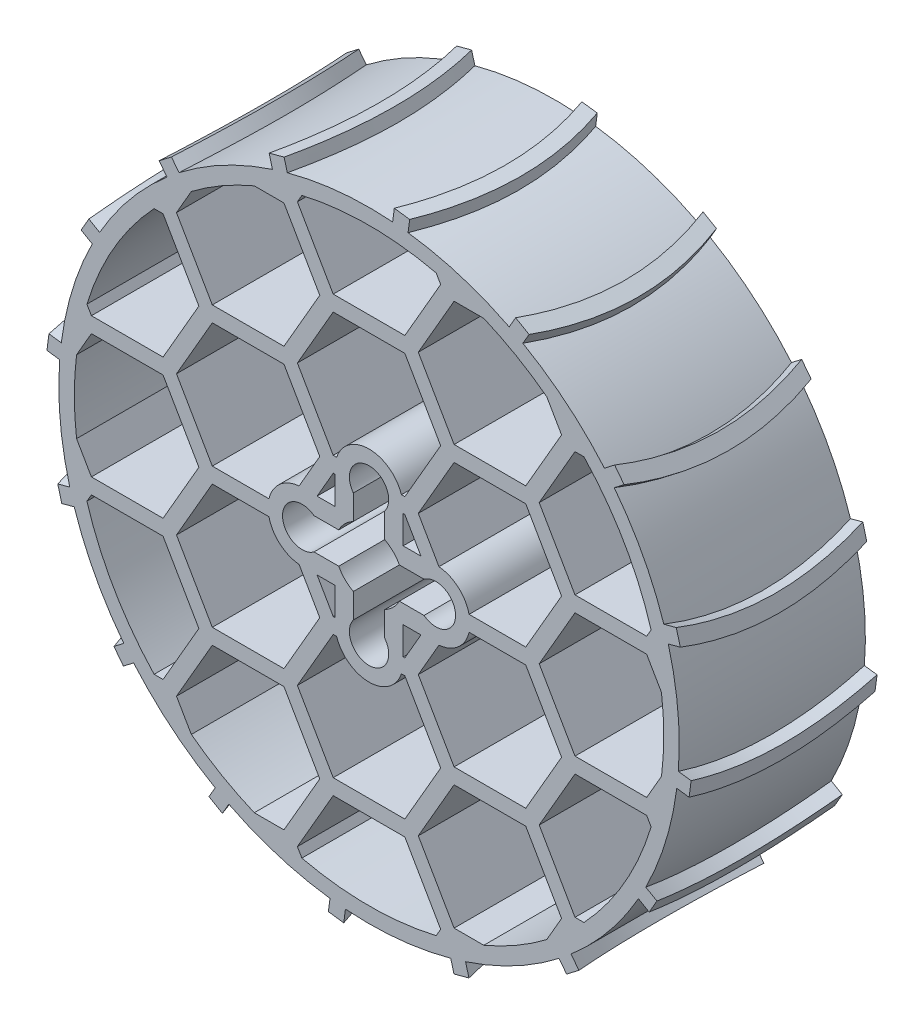
from build123d import *

# Parameters (mm, degrees)
BOSS_EXTRUDE1_DEPTH = 60
SKETCH1_4_R         = 6.338999997
SKETCH1_4_R_2       = 3.302
SKETCH1_4_R_3       = 6.339
SKETCH1_4_R_4       = 6.338999989
BOSS_EXTRUDE2_DEPTH = 10
SKETCH1_6_R         = 6.339
SKETCH1_6_R_2       = 3.302
SKETCH1_6_R_3       = 6.338999989
SKETCH1_6_R_4       = 6.338999997
BOSS_EXTRUDE4_DEPTH = 30
SKETCH1_7_R         = 100
SKETCH1_7_R_2       = 95
BOSS_EXTRUDE5_DEPTH = 60
BOSS_EXTRUDE6_START = -0.149920562
BOSS_EXTRUDE6_DEPTH = 4.149920562
CIRPATTERN3_COUNT   = 16


with BuildPart() as part:
    # Sketch1 → Boss-Extrude1 (new body)
    with BuildSketch(Plane.XY):
        with BuildLine():
            Line((-11.547005384, 70), (-23.094010768, 90))
            Line((-23.094010768, 90), (-21.650635095, 92.5))
            ThreePointArc((-21.650635095, 92.5), (-29.430004682, 90.326490159), (-36.996621467, 87.5))
            Line((-36.996621467, 87.5), (-27.424137787, 87.5))
            Line((-27.424137787, 87.5), (-15.877132403, 67.5))
            Line((-15.877132403, 67.5), (-27.424137787, 47.5))
            Line((-27.424137787, 47.5), (-50.518148554, 47.5))
            Line((-50.518148554, 47.5), (-62.065153938, 67.5))
            Line((-62.065153938, 67.5), (-57.278912097, 75.790014045))
            ThreePointArc((-57.278912097, 75.790014045), (-63.510032772, 70.650376767), (-69.282032303, 65))
            Line((-69.282032303, 65), (-66.395280957, 65))
            Line((-66.395280957, 65), (-54.848275573, 45))
            Line((-54.848275573, 45), (-66.395280957, 25))
            Line((-66.395280957, 25), (-89.489291724, 25))
            Line((-89.489291724, 25), (-90.932667397, 27.5))
            ThreePointArc((-90.932667397, 27.5), (-92.940037453, 19.676113392), (-94.275533565, 11.709985955))
            Line((-94.275533565, 11.709985955), (-89.489291724, 20))
            Line((-89.489291724, 20), (-66.395280957, 20))
            Line((-66.395280957, 20), (-54.848275573, 0))
            Line((-54.848275573, 0), (-66.395280957, -20))
            Line((-66.395280957, -20), (-89.489291724, -20))
            Line((-89.489291724, -20), (-94.275533565, -11.709985955))
            ThreePointArc((-94.275533565, -11.709985955), (-92.940037453, -19.676113392), (-90.932667397, -27.5))
            Line((-90.932667397, -27.5), (-89.489291724, -25))
            Line((-89.489291724, -25), (-66.395280957, -25))
            Line((-66.395280957, -25), (-54.848275573, -45))
            Line((-54.848275573, -45), (-66.395280957, -65))
            Line((-66.395280957, -65), (-69.282032303, -65))
            ThreePointArc((-69.282032303, -65), (-63.510032772, -70.650376767), (-57.278912097, -75.790014045))
            Line((-57.278912097, -75.790014045), (-62.065153938, -67.5))
            Line((-62.065153938, -67.5), (-50.518148554, -47.5))
            Line((-50.518148554, -47.5), (-27.424137786, -47.5))
            Line((-27.424137786, -47.5), (-15.877132403, -67.5))
            Line((-15.877132403, -67.5), (-27.424137787, -87.5))
            Line((-27.424137787, -87.5), (-36.996621467, -87.5))
            ThreePointArc((-36.996621467, -87.5), (-29.430004682, -90.326490159), (-21.650635095, -92.5))
            Line((-21.650635095, -92.5), (-23.094010768, -90))
            Line((-23.094010768, -90), (-11.547005384, -70))
            Line((-11.547005384, -70), (11.547005384, -70))
            Line((11.547005384, -70), (23.094010768, -90))
            Line((23.094010768, -90), (21.650635095, -92.5))
            ThreePointArc((21.650635095, -92.5), (29.430004682, -90.326490159), (36.996621467, -87.5))
            Line((36.996621467, -87.5), (27.424137787, -87.5))
            Line((27.424137787, -87.5), (15.877132403, -67.5))
            Line((15.877132403, -67.5), (27.424137787, -47.5))
            Line((27.424137787, -47.5), (50.518148554, -47.5))
            Line((50.518148554, -47.5), (62.065153938, -67.5))
            Line((62.065153938, -67.5), (57.278912097, -75.790014045))
            ThreePointArc((57.278912097, -75.790014045), (63.510032772, -70.650376767), (69.282032303, -65))
            Line((69.282032303, -65), (66.395280957, -65))
            Line((66.395280957, -65), (54.848275573, -45))
            Line((54.848275573, -45), (66.395280957, -25))
            Line((66.395280957, -25), (89.489291724, -25))
            Line((89.489291724, -25), (90.932667397, -27.5))
            ThreePointArc((90.932667397, -27.5), (92.940037453, -19.676113392), (94.275533565, -11.709985955))
            Line((94.275533565, -11.709985955), (89.489291724, -20))
            Line((89.489291724, -20), (66.395280957, -20))
            Line((66.395280957, -20), (54.848275573, 0))
            Line((54.848275573, 0), (66.395280957, 20))
            Line((66.395280957, 20), (89.489291724, 20))
            Line((89.489291724, 20), (94.275533565, 11.709985955))
            ThreePointArc((94.275533565, 11.709985955), (92.940037453, 19.676113392), (90.932667397, 27.5))
            Line((90.932667397, 27.5), (89.489291724, 25))
            Line((89.489291724, 25), (66.395280957, 25))
            Line((66.395280957, 25), (54.848275573, 45))
            Line((54.848275573, 45), (66.395280957, 65))
            Line((66.395280957, 65), (69.282032303, 65))
            ThreePointArc((69.282032303, 65), (63.510032772, 70.650376767), (57.278912097, 75.790014045))
            Line((57.278912097, 75.790014045), (62.065153938, 67.5))
            Line((62.065153938, 67.5), (50.518148554, 47.5))
            Line((50.518148554, 47.5), (27.424137787, 47.5))
            Line((27.424137787, 47.5), (15.877132403, 67.5))
            Line((15.877132403, 67.5), (27.424137787, 87.5))
            Line((27.424137787, 87.5), (36.996621467, 87.5))
            ThreePointArc((36.996621467, 87.5), (29.430004682, 90.326490159), (21.650635095, 92.5))
            Line((21.650635095, 92.5), (23.094010768, 90))
            Line((23.094010768, 90), (11.547005384, 70))
            Line((11.547005384, 70), (-11.547005384, 70))
        make_face()
        Polygon((-10.999999956, 20), (-10.999999956, 11.000000024), (-16.743157793, 11.000000024), (-11.547005384, 20), align=None, mode=Mode.SUBTRACT)
        with BuildLine():
            ThreePointArc((10.444314098, 25), (5.1e-08, 32.547999973), (-10.444313996, 25))
            Line((-10.444313996, 25), (-11.547005384, 25))
            Line((-11.547005384, 25), (-23.094010768, 45))
            Line((-23.094010768, 45), (-11.547005384, 65))
            Line((-11.547005384, 65), (11.547005384, 65))
            Line((11.547005384, 65), (23.094010768, 45))
            Line((23.094010768, 45), (11.547005384, 25))
            Line((11.547005384, 25), (10.444314098, 25))
        make_face(mode=Mode.SUBTRACT)
        Polygon((11.000000057, 11.000000006), (11.000000057, 20), (11.547005384, 20), (16.743157803, 11.000000006), align=None, mode=Mode.SUBTRACT)
        with BuildLine():
            ThreePointArc((-22.54267841, 10.954935656), (-28.768380763, 8.298560168), (-32.26014257, 2.5))
            Line((-32.26014257, 2.5), (-50.518148554, 2.5))
            Line((-50.518148554, 2.5), (-62.065153938, 22.5))
            Line((-62.065153938, 22.5), (-50.518148554, 42.5))
            Line((-50.518148554, 42.5), (-27.424137787, 42.5))
            Line((-27.424137787, 42.5), (-15.877132403, 22.5))
            Line((-15.877132403, 22.5), (-22.54267841, 10.954935656))
        make_face(mode=Mode.SUBTRACT)
        with BuildLine():
            ThreePointArc((-32.260142561, -2.5), (-28.768380758, -8.298560137), (-22.542678431, -10.954935619))
            Line((-22.542678431, -10.954935619), (-15.877132403, -22.5))
            Line((-15.877132403, -22.5), (-27.424137787, -42.5))
            Line((-27.424137787, -42.5), (-50.518148554, -42.5))
            Line((-50.518148554, -42.5), (-62.065153938, -22.5))
            Line((-62.065153938, -22.5), (-50.518148554, -2.5))
            Line((-50.518148554, -2.5), (-32.260142561, -2.5))
        make_face(mode=Mode.SUBTRACT)
        with BuildLine():
            ThreePointArc((32.260142649, 2.5), (28.768380811, 8.298560182), (22.542678416, 10.954935645))
            Line((22.542678416, 10.954935645), (15.877132403, 22.5))
            Line((15.877132403, 22.5), (27.424137787, 42.5))
            Line((27.424137787, 42.5), (50.518148554, 42.5))
            Line((50.518148554, 42.5), (62.065153938, 22.5))
            Line((62.065153938, 22.5), (50.518148554, 2.5))
            Line((50.518148554, 2.5), (32.260142649, 2.5))
        make_face(mode=Mode.SUBTRACT)
        Polygon((-16.743157813, -10.999999989), (-10.999999973, -10.999999989), (-10.999999973, -20), (-11.547005384, -20), align=None, mode=Mode.SUBTRACT)
        with BuildLine():
            ThreePointArc((22.542678416, -10.954935645), (28.768380811, -8.298560182), (32.260142649, -2.5))
            Line((32.260142649, -2.5), (50.518148554, -2.5))
            Line((50.518148554, -2.5), (62.065153938, -22.5))
            Line((62.065153938, -22.5), (50.518148554, -42.5))
            Line((50.518148554, -42.5), (27.424137787, -42.5))
            Line((27.424137787, -42.5), (15.877132403, -22.5))
            Line((15.877132403, -22.5), (22.542678416, -10.954935645))
        make_face(mode=Mode.SUBTRACT)
        with BuildLine():
            ThreePointArc((-10.444314008, -25), (3.3e-08, -32.547999956), (10.444314074, -25))
            Line((10.444314074, -25), (11.547005384, -25))
            Line((11.547005384, -25), (23.094010768, -45))
            Line((23.094010768, -45), (11.547005384, -65))
            Line((11.547005384, -65), (-11.547005384, -65))
            Line((-11.547005384, -65), (-23.094010768, -45))
            Line((-23.094010768, -45), (-11.547005384, -25))
            Line((-11.547005384, -25), (-10.444314008, -25))
        make_face(mode=Mode.SUBTRACT)
        Polygon((11.00000004, -11.000000006), (16.743157803, -11.000000006), (11.547005384, -20), (11.00000004, -20), align=None, mode=Mode.SUBTRACT)
        with BuildLine():
            Line((9.767988869, 5.058299477), (17.727459807, 5.058299477))
            ThreePointArc((17.72745981, 5.058299474), (27.886999964, -4.5e-08), (17.727459795, -5.058299534))
            Line((17.727459789, -5.058299543), (9.767988835, -5.058299543))
            ThreePointArc((9.767988835, -5.058299543), (7.778174571, -7.778174624), (5.058299477, -9.767988869))
            Line((5.058299477, -9.767988869), (5.058299477, -17.727459807))
            ThreePointArc((5.058299479, -17.727459806), (-5e-08, -27.886999949), (-5.058299543, -17.727459788))
            Line((-5.058299543, -17.727459789), (-5.058299543, -9.767988835))
            ThreePointArc((-5.058299543, -9.767988835), (-7.778174624, -7.778174571), (-9.767988869, -5.058299477))
            Line((-9.767988869, -5.058299477), (-17.727459807, -5.058299477))
            ThreePointArc((-17.72745982, -5.05829946), (-27.886999941, 7.3e-08), (-17.727459789, 5.058299543))
            Line((-17.727459789, 5.058299543), (-9.767988835, 5.058299543))
            ThreePointArc((-9.767988835, 5.058299543), (-7.778174571, 7.778174624), (-5.058299477, 9.767988869))
            Line((-5.058299477, 9.767988869), (-5.058299477, 17.727459807))
            ThreePointArc((-5.058299461, 17.72745982), (6.9e-08, 27.886999964), (5.05829954, 17.727459791))
            Line((5.058299543, 17.727459789), (5.058299543, 9.767988835))
            ThreePointArc((5.058299543, 9.767988835), (7.778174624, 7.778174571), (9.767988869, 5.058299477))
        make_face(mode=Mode.SUBTRACT)
    extrude(amount=BOSS_EXTRUDE1_DEPTH)

    # Sketch1<4> → Boss-Extrude2 (add)
    # profile 1 of 4: a face of its own
    with BuildSketch(Plane.XY):
        with Locations((5.1e-08, 21.547999967)):
            Circle(SKETCH1_4_R)
        with Locations((5.1e-08, 21.547999967)):
            Circle(SKETCH1_4_R_2, mode=Mode.SUBTRACT)
    # profile 2 of 4: a face of its own
    with BuildSketch(Plane.XY):
        with Locations((21.547999964, -3.6e-08)):
            Circle(SKETCH1_4_R_3)
        with Locations((21.547999974, -2.6e-08)):
            Circle(SKETCH1_4_R_2, mode=Mode.SUBTRACT)
    # profile 3 of 4: a face of its own
    with BuildSketch(Plane.XY):
        with Locations((-21.547999952, 5.4e-08)):
            Circle(SKETCH1_4_R_4)
        with Locations((-21.547999942, 4.4e-08)):
            Circle(SKETCH1_4_R_2, mode=Mode.SUBTRACT)
    # profile 4 of 4: a face of its own
    with BuildSketch(Plane.XY):
        with Locations((-3.9e-08, -21.547999949)):
            Circle(SKETCH1_4_R_3)
        with Locations((-1.9e-08, -21.547999949)):
            Circle(SKETCH1_4_R_2, mode=Mode.SUBTRACT)
    extrude(amount=BOSS_EXTRUDE2_DEPTH)

    # Sketch1<6> → Boss-Extrude4 (add)
    # profile 1 of 4: a face of its own
    with BuildSketch(Plane.XY):
        with Locations((-3.9e-08, -21.547999949)):
            Circle(SKETCH1_6_R)
        with Locations((-1.9e-08, -21.547999949)):
            Circle(SKETCH1_6_R_2, mode=Mode.SUBTRACT)
    # profile 2 of 4: a face of its own
    with BuildSketch(Plane.XY):
        with Locations((-21.547999952, 5.4e-08)):
            Circle(SKETCH1_6_R_3)
        with Locations((-21.547999942, 4.4e-08)):
            Circle(SKETCH1_6_R_2, mode=Mode.SUBTRACT)
    # profile 3 of 4: a face of its own
    with BuildSketch(Plane.XY):
        with Locations((21.547999964, -3.6e-08)):
            Circle(SKETCH1_6_R)
        with Locations((21.547999974, -2.6e-08)):
            Circle(SKETCH1_6_R_2, mode=Mode.SUBTRACT)
    # profile 4 of 4: a face of its own
    with BuildSketch(Plane.XY):
        with Locations((5.1e-08, 21.547999967)):
            Circle(SKETCH1_6_R_4)
        with Locations((5.1e-08, 21.547999967)):
            Circle(SKETCH1_6_R_2, mode=Mode.SUBTRACT)
    extrude(amount=BOSS_EXTRUDE4_DEPTH)

    # Sketch1<7> → Boss-Extrude5 (add)
    with BuildSketch(Plane.XY):
        Circle(SKETCH1_7_R)
        Circle(SKETCH1_7_R_2, mode=Mode.SUBTRACT)
    extrude(amount=BOSS_EXTRUDE5_DEPTH)

    # Boss-Extrude6: read off the stored shape, not the designer's step
    # Boss-Extrude6 outline → Boss-Extrude6 (add)
    with BuildSketch(Plane(origin=(50, 86.602540378, 0), x_dir=(0.8660254037844335, -0.5000000000000091, 0), z_dir=(0.500000000000009, 0.8660254037844334, 0)).offset(BOSS_EXTRUDE6_START)):
        with BuildLine():
            add(Edge.make_bspline(
                [(0, 0), (9.762549654, -30.076815135), (-0.473720509, -60)],
                knots=[0, 0, 0, 1, 1, 1], degree=2))
            Line((0, 0), (-5, 0))
            add(Edge.make_bspline(
                [(-5, 0), (4.762549654, -30.076815135), (-5.473720509, -60)],
                knots=[0, 0, 0, 1, 1, 1], degree=2))
            Line((-5.473720509, -60), (-0.473720509, -60))
        make_face()
    boss_extrude6 = extrude(amount=BOSS_EXTRUDE6_DEPTH)

    # CirPattern3: Boss-Extrude6 ×16 about axis
    cirpattern3_axis = Axis((0, 0, 60), (0, 0, -1))
    for i in range(1, CIRPATTERN3_COUNT):
        add(boss_extrude6.rotate(cirpattern3_axis, i * 360 / CIRPATTERN3_COUNT))


solid = part.part
